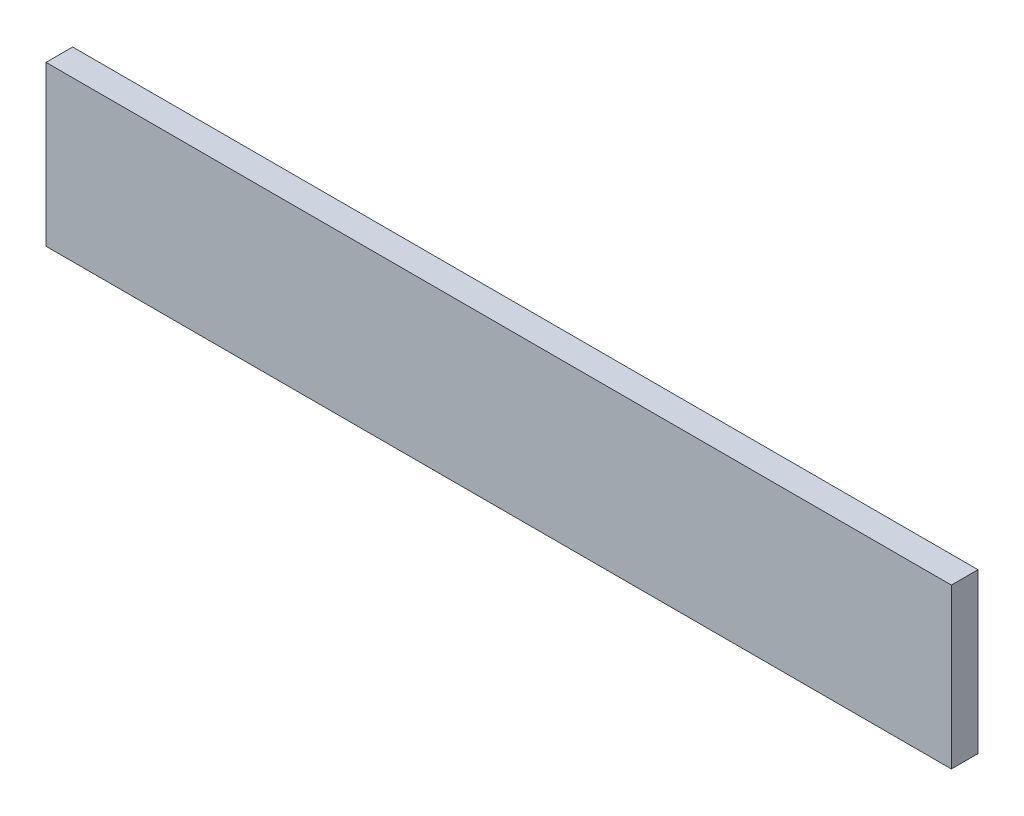
from build123d import *

# Parameters (mm, degrees)
SKETCH1_W           = 340
SKETCH1_H           = 59.82575695
BOSS_EXTRUDE1_DEPTH = 10


with BuildPart() as part:
    # Sketch1 → Boss-Extrude1 (new body)
    with BuildSketch(Plane.XY):
        with Locations((100, 22.912878475)):
            Rectangle(SKETCH1_W, SKETCH1_H)
    extrude(amount=BOSS_EXTRUDE1_DEPTH)


solid = part.part
